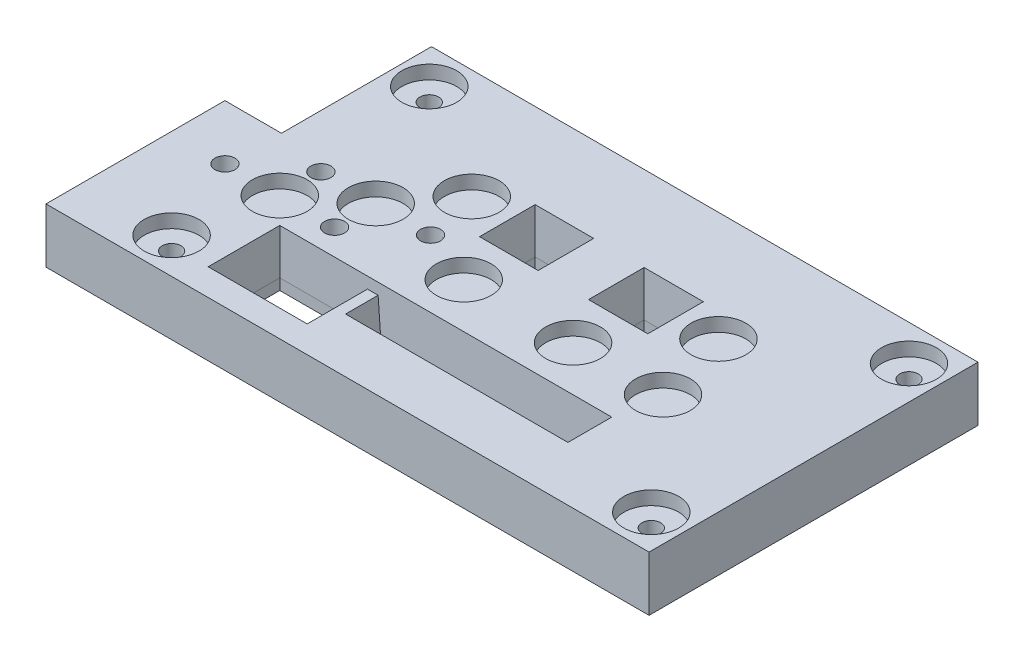
from build123d import *

# Parameters (mm, degrees)
SKETCH1_W               = 220
SKETCH1_H               = 120
BOSS_EXTRUDE1_DEPTH     = 20
CUT_EXTRUDE1_REACH      = 128.886
SKETCH2_W               = 20.632503002
SKETCH2_H               = 54.730004003
CUT_EXTRUDE2_REACH      = 128.886
SKETCH3_W               = 20.25
SKETCH3_H               = 19.16
SKETCH3_W_2             = 20.5
CUT_EXTRUDE3_REACH      = 128.886
SKETCH4_W               = 80
SKETCH4_H               = 14.88
CUT_EXTRUDE4_REACH      = 128.886
SKETCH8_R               = 3.1
CUT_EXTRUDE5_REACH      = 128.886
CUT_EXTRUDE6_DEPTH      = 127.885775404
CUT_EXTRUDE6_DEPTH_BACK = 5
SKETCH10_R              = 10
M8_TAPPED_HOLE1_D       = 6.8
SKETCH14_R              = 7.5
CUT_EXTRUDE7_DEPTH      = 3


with BuildPart() as part:
    # Sketch1 → Boss-Extrude1 (new body)
    with BuildSketch(Plane(origin=(0, 0, 0), x_dir=(1, 0, 0), z_dir=(0, 1, 0))):
        Rectangle(SKETCH1_W, SKETCH1_H)
    extrude(amount=-BOSS_EXTRUDE1_DEPTH)

    # Sketch2 → Cut-Extrude1 (cut, up to next)
    with BuildSketch(Plane(origin=(0, 0, 0), x_dir=(1, 0, 0), z_dir=(0, 1, 0)), mode=Mode.PRIVATE) as cut_extrude1_sk1:
        with Locations((-99.683748499, 32.634997999)):
            Rectangle(SKETCH2_W, SKETCH2_H)
    cut_extrude1_tool1 = extrude(cut_extrude1_sk1.sketch, amount=-CUT_EXTRUDE1_REACH, mode=Mode.PRIVATE) & part.part
    add(cut_extrude1_tool1.solids().sort_by_distance((-99.683748, 0, -32.634998))[0], mode=Mode.SUBTRACT)

    # Sketch3 → Cut-Extrude2 (cut, up to next)
    with BuildSketch(Plane(origin=(0, 0, 0), x_dir=(1, 0, 0), z_dir=(0, 1, 0)), mode=Mode.PRIVATE) as cut_extrude2_sk1:
        with Locations((-9.875, 18.86)):
            Rectangle(SKETCH3_W, SKETCH3_H)
    cut_extrude2_tool1 = extrude(cut_extrude2_sk1.sketch, amount=-CUT_EXTRUDE2_REACH, mode=Mode.PRIVATE) & part.part
    # Sketch3 → Cut-Extrude2 (cut, up to next)
    with BuildSketch(Plane(origin=(0, 0, 0), x_dir=(1, 0, 0), z_dir=(0, 1, 0)), mode=Mode.PRIVATE) as cut_extrude2_sk2:
        with Locations((30, 18.86)):
            Rectangle(SKETCH3_W_2, SKETCH3_H)
    cut_extrude2_tool2 = extrude(cut_extrude2_sk2.sketch, amount=-CUT_EXTRUDE2_REACH, mode=Mode.PRIVATE) & part.part
    add(cut_extrude2_tool1.solids().sort_by_distance((-9.875, 0, -18.86))[0], mode=Mode.SUBTRACT)
    add(cut_extrude2_tool2.solids().sort_by_distance((30, 0, -18.86))[0], mode=Mode.SUBTRACT)

    # Sketch4 → Cut-Extrude3 (cut, up to next)
    with BuildSketch(Plane(origin=(0, 0, 0), x_dir=(1, 0, 0), z_dir=(0, 1, 0)), mode=Mode.PRIVATE) as cut_extrude3_sk1:
        with Locations((20, -32.16)):
            Rectangle(SKETCH4_W, SKETCH4_H)
    cut_extrude3_tool1 = extrude(cut_extrude3_sk1.sketch, amount=-CUT_EXTRUDE3_REACH, mode=Mode.PRIVATE) & part.part
    add(cut_extrude3_tool1.solids().sort_by_distance((20, 0, 32.16))[0], mode=Mode.SUBTRACT)

    # Sketch8 → Cut-Extrude4 (cut, up to next)
    with BuildSketch(Plane(origin=(0, 0, 0), x_dir=(1, 0, 0), z_dir=(0, 1, 0)), mode=Mode.PRIVATE) as cut_extrude4_sk1:
        with Locations(Location((-90, -14.72, 0), (0, 0, 270))):
            Circle(SKETCH8_R)
    cut_extrude4_tool1 = extrude(cut_extrude4_sk1.sketch, amount=-CUT_EXTRUDE4_REACH, mode=Mode.PRIVATE) & part.part
    # Sketch8 → Cut-Extrude4 (cut, up to next)
    with BuildSketch(Plane(origin=(0, 0, 0), x_dir=(1, 0, 0), z_dir=(0, 1, 0)), mode=Mode.PRIVATE) as cut_extrude4_sk2:
        with Locations(Location((-30, 0.28, 0), (0, 0, 270))):
            Circle(SKETCH8_R)
    cut_extrude4_tool2 = extrude(cut_extrude4_sk2.sketch, amount=-CUT_EXTRUDE4_REACH, mode=Mode.PRIVATE) & part.part
    # Sketch8 → Cut-Extrude4 (cut, up to next)
    with BuildSketch(Plane(origin=(0, 0, 0), x_dir=(1, 0, 0), z_dir=(0, 1, 0)), mode=Mode.PRIVATE) as cut_extrude4_sk3:
        with Locations(Location((-70, 0.28, 0), (0, 0, 270))):
            Circle(SKETCH8_R)
    cut_extrude4_tool3 = extrude(cut_extrude4_sk3.sketch, amount=-CUT_EXTRUDE4_REACH, mode=Mode.PRIVATE) & part.part
    # Sketch8 → Cut-Extrude4 (cut, up to next)
    with BuildSketch(Plane(origin=(0, 0, 0), x_dir=(1, 0, 0), z_dir=(0, 1, 0)), mode=Mode.PRIVATE) as cut_extrude4_sk4:
        with Locations(Location((-50, -14.72, 0), (0, 0, 270))):
            Circle(SKETCH8_R)
    cut_extrude4_tool4 = extrude(cut_extrude4_sk4.sketch, amount=-CUT_EXTRUDE4_REACH, mode=Mode.PRIVATE) & part.part
    add(cut_extrude4_tool1.solids().sort_by_distance((-90, 0, 14.72))[0], mode=Mode.SUBTRACT)
    add(cut_extrude4_tool2.solids().sort_by_distance((-30, 0, -0.28))[0], mode=Mode.SUBTRACT)
    add(cut_extrude4_tool3.solids().sort_by_distance((-70, 0, -0.28))[0], mode=Mode.SUBTRACT)
    add(cut_extrude4_tool4.solids().sort_by_distance((-50, 0, 14.72))[0], mode=Mode.SUBTRACT)

    # Sketch9 → Cut-Extrude5 (cut, up to next)
    with BuildSketch(Plane(origin=(0, 0, 0), x_dir=(1, 0, 0), z_dir=(0, 1, 0)), mode=Mode.PRIVATE) as cut_extrude5_sk1:
        Polygon((-20, -27.72), (-25, -27.72), (-25, -49.72), (-60, -49.72), (-60, -24.72), (-20, -24.72), align=None)
    cut_extrude5_tool1 = extrude(cut_extrude5_sk1.sketch, amount=-CUT_EXTRUDE5_REACH, mode=Mode.PRIVATE) & part.part
    add(cut_extrude5_tool1.solids().sort_by_distance((-42.162921, 0, 37.034607))[0], mode=Mode.SUBTRACT)

    # Sketch10 → Cut-Extrude6 (cut, two sides: drawn at the far end of the back side and taken through both)
    with BuildSketch(Plane(origin=(0, 0, 0), x_dir=(1, 0, 0), z_dir=(0, 1, 0)).offset(-CUT_EXTRUDE6_DEPTH_BACK)):
        with Locations(Location((-77.183748499, 47, 0), (0, 0, 90))):
            Circle(SKETCH10_R)
        with Locations(Location((-34.683748499, 20, 0), (0, 0, 90))):
            Circle(SKETCH10_R)
        with Locations(Location((97.816251501, 47, 0), (0, 0, 90))):
            Circle(SKETCH10_R)
        with Locations(Location((30, -7.72, 0), (0, 0, 90))):
            Circle(SKETCH10_R)
        with Locations(Location((55.316251501, 20, 0), (0, 0, 90))):
            Circle(SKETCH10_R)
        with Locations(Location((-9.875, -7.72, 0), (0, 0, 90))):
            Circle(SKETCH10_R)
        with Locations(Location((97.816251501, -47, 0), (0, 0, 90))):
            Circle(SKETCH10_R)
        with Locations(Location((-50, 0.28, 0), (0, 0, 90))):
            Circle(SKETCH10_R)
        with Locations(Location((62.816251501, -7.72, 0), (0, 0, 90))):
            Circle(SKETCH10_R)
        with Locations(Location((-70, -14.72, 0), (0, 0, 90))):
            Circle(SKETCH10_R)
        with Locations(Location((-77.183748499, -47, 0), (0, 0, 90))):
            Circle(SKETCH10_R)
    extrude(amount=CUT_EXTRUDE6_DEPTH + CUT_EXTRUDE6_DEPTH_BACK, mode=Mode.SUBTRACT)

    # M8 Tapped Hole1 (through all)
    with Locations(Plane(origin=(0, -5, 0), x_dir=(1, 0, 0), z_dir=(0, 1, 0))):
        with Locations((-77.183748499, 47), (97.816251501, 47), (97.816251501, -47), (-77.183748499, -47)):
            Hole(M8_TAPPED_HOLE1_D / 2)

    # Sketch14 → Cut-Extrude7 (cut)
    with BuildSketch(Plane.XZ.offset(20)):
        with Locations(Location((78, -30, 0), (0, 0, 270))):
            Circle(SKETCH14_R)
        with Locations(Location((98, -30, 0), (0, 0, 270))):
            Circle(SKETCH14_R)
        with Locations(Location((-70, -30, 0), (0, 0, 270))):
            Circle(SKETCH14_R)
        with Locations(Location((-70, 27.22, 0), (0, 0, 270))):
            Circle(SKETCH14_R)
        with Locations(Location((78, 30.5, 0), (0, 0, 270))):
            Circle(SKETCH14_R)
        with Locations(Location((98, 30.5, 0), (0, 0, 270))):
            Circle(SKETCH14_R)
    extrude(amount=-CUT_EXTRUDE7_DEPTH, mode=Mode.SUBTRACT)

    # Draft1: read off the stored shape, not the designer's step
    # Draft1: loft between two sections, ruled curve by curve
    draft1_from = [
        Edge.make_line((19.191267688, 0, -8.721267688), (40.808732312, 0, -8.721267688)),
        Edge.make_line((19.191267688, 0, -28.998732312), (19.191267688, 0, -8.721267688)),
        Edge.make_line((40.808732312, 0, -28.998732312), (19.191267688, 0, -28.998732312)),
        Edge.make_line((40.808732312, 0, -8.721267688), (40.808732312, 0, -28.998732312)),
    ]
    draft1_to = [
        Edge.make_line((19.75, -16, -9.28), (40.25, -16, -9.28)),
        Edge.make_line((19.75, -16, -28.44), (19.75, -16, -9.28)),
        Edge.make_line((40.25, -16, -28.44), (19.75, -16, -28.44)),
        Edge.make_line((40.25, -16, -9.28), (40.25, -16, -28.44)),
    ]
    draft1 = Solid(Shell([*[Face.make_surface_from_curves(draft1_from[k], draft1_to[k]) for k in range(4)], Face(Wire(draft1_from)), Face(Wire(draft1_to))]))
    add(draft1, mode=Mode.SUBTRACT)

    # Draft1 2: loft between two sections, ruled curve by curve
    draft1_2_from = [
        Edge.make_line((-20.558732312, 0, -8.721267688), (0.808732312, 0, -8.721267688)),
        Edge.make_line((0.808732312, 0, -28.998732312), (-20.558732312, 0, -28.998732312)),
        Edge.make_line((-20.558732312, 0, -28.998732312), (-20.558732312, 0, -8.721267688)),
        Edge.make_line((0.808732312, 0, -8.721267688), (0.808732312, 0, -28.998732312)),
    ]
    draft1_2_to = [
        Edge.make_line((-20, -16, -9.28), (0.25, -16, -9.28)),
        Edge.make_line((0.25, -16, -28.44), (-20, -16, -28.44)),
        Edge.make_line((-20, -16, -28.44), (-20, -16, -9.28)),
        Edge.make_line((0.25, -16, -9.28), (0.25, -16, -28.44)),
    ]
    draft1_2 = Solid(Shell([*[Face.make_surface_from_curves(draft1_2_from[k], draft1_2_to[k]) for k in range(4)], Face(Wire(draft1_2_from)), Face(Wire(draft1_2_to))]))
    add(draft1_2, mode=Mode.SUBTRACT)

    # Draft1 3: loft between two sections, ruled curve by curve
    draft1_3_from = [
        Edge.make_line((-20.558732312, 0, 28.278732312), (-20.558732312, 0, 40.158732312)),
        Edge.make_line((60.558732312, 0, 40.158732312), (60.558732312, 0, 24.161267688)),
        Edge.make_line((-20.558732312, 0, 40.158732312), (60.558732312, 0, 40.158732312)),
        Edge.make_line((60.558732312, 0, 24.161267688), (-60.558732312, 0, 24.161267688)),
        Edge.make_line((-24.441267688, 0, 28.278732312), (-20.558732312, 0, 28.278732312)),
        Edge.make_line((-24.441267688, 0, 50.278732312), (-24.441267688, 0, 28.278732312)),
        Edge.make_line((-60.558732312, 0, 50.278732312), (-24.441267688, 0, 50.278732312)),
        Edge.make_line((-60.558732312, 0, 24.161267688), (-60.558732312, 0, 50.278732312)),
    ]
    draft1_3_to = [
        Edge.make_line((-20, -16, 27.72), (-20, -16, 39.6)),
        Edge.make_line((60, -16, 39.6), (60, -16, 24.72)),
        Edge.make_line((-20, -16, 39.6), (60, -16, 39.6)),
        Edge.make_line((60, -16, 24.72), (-60, -16, 24.72)),
        Edge.make_line((-25, -16, 27.72), (-20, -16, 27.72)),
        Edge.make_line((-25, -16, 49.72), (-25, -16, 27.72)),
        Edge.make_line((-60, -16, 49.72), (-25, -16, 49.72)),
        Edge.make_line((-60, -16, 24.72), (-60, -16, 49.72)),
    ]
    draft1_3 = Solid(Shell([*[Face.make_surface_from_curves(draft1_3_from[k], draft1_3_to[k]) for k in range(8)], Face(Wire(draft1_3_from)), Face(Wire(draft1_3_to))]))
    add(draft1_3, mode=Mode.SUBTRACT)

    # Draft1 4: loft between two sections, ruled curve by curve
    draft1_4_from = [
        Edge.make_three_point_arc((-50, -16, 11.62), (-53.1, -16, 14.72), (-50, -16, 17.82)),
        Edge.make_three_point_arc((-50, -16, 17.82), (-46.9, -16, 14.72), (-50, -16, 11.62)),
    ]
    draft1_4_to = [
        Edge.make_three_point_arc((-50, 0, 11.061267688), (-53.658732312, 0, 14.72), (-50, 0, 18.378732312)),
        Edge.make_three_point_arc((-50, 0, 18.378732312), (-46.341267688, 0, 14.72), (-50, 0, 11.061267688)),
    ]
    draft1_4 = Solid(Shell([*[Face.make_surface_from_curves(draft1_4_from[k], draft1_4_to[k]) for k in range(2)], Face(Wire(draft1_4_from)), Face(Wire(draft1_4_to))]))
    add(draft1_4, mode=Mode.SUBTRACT)

    # Draft1 5: loft between two sections, ruled curve by curve
    draft1_5_from = [
        Edge.make_three_point_arc((-70, -16, -3.38), (-73.1, -16, -0.28), (-70, -16, 2.82)),
        Edge.make_three_point_arc((-70, -16, 2.82), (-66.9, -16, -0.28), (-70, -16, -3.38)),
    ]
    draft1_5_to = [
        Edge.make_three_point_arc((-70, 0, -3.938732312), (-73.658732312, 0, -0.28), (-70, 0, 3.378732312)),
        Edge.make_three_point_arc((-70, 0, 3.378732312), (-66.341267688, 0, -0.28), (-70, 0, -3.938732312)),
    ]
    draft1_5 = Solid(Shell([*[Face.make_surface_from_curves(draft1_5_from[k], draft1_5_to[k]) for k in range(2)], Face(Wire(draft1_5_from)), Face(Wire(draft1_5_to))]))
    add(draft1_5, mode=Mode.SUBTRACT)

    # Draft1 6: loft between two sections, ruled curve by curve
    draft1_6_from = [
        Edge.make_three_point_arc((-30, -16, -3.38), (-33.1, -16, -0.28), (-30, -16, 2.82)),
        Edge.make_three_point_arc((-30, -16, 2.82), (-26.9, -16, -0.28), (-30, -16, -3.38)),
    ]
    draft1_6_to = [
        Edge.make_three_point_arc((-30, 0, -3.938732312), (-33.658732312, 0, -0.28), (-30, 0, 3.378732312)),
        Edge.make_three_point_arc((-30, 0, 3.378732312), (-26.341267688, 0, -0.28), (-30, 0, -3.938732312)),
    ]
    draft1_6 = Solid(Shell([*[Face.make_surface_from_curves(draft1_6_from[k], draft1_6_to[k]) for k in range(2)], Face(Wire(draft1_6_from)), Face(Wire(draft1_6_to))]))
    add(draft1_6, mode=Mode.SUBTRACT)

    # Draft1 7: loft between two sections, ruled curve by curve
    draft1_7_from = [
        Edge.make_three_point_arc((-90, -16, 11.62), (-93.1, -16, 14.72), (-90, -16, 17.82)),
        Edge.make_three_point_arc((-90, -16, 17.82), (-86.9, -16, 14.72), (-90, -16, 11.62)),
    ]
    draft1_7_to = [
        Edge.make_three_point_arc((-90, 0, 11.061267688), (-93.658732312, 0, 14.72), (-90, 0, 18.378732312)),
        Edge.make_three_point_arc((-90, 0, 18.378732312), (-86.341267688, 0, 14.72), (-90, 0, 11.061267688)),
    ]
    draft1_7 = Solid(Shell([*[Face.make_surface_from_curves(draft1_7_from[k], draft1_7_to[k]) for k in range(2)], Face(Wire(draft1_7_from)), Face(Wire(draft1_7_to))]))
    add(draft1_7, mode=Mode.SUBTRACT)


solid = part.part
